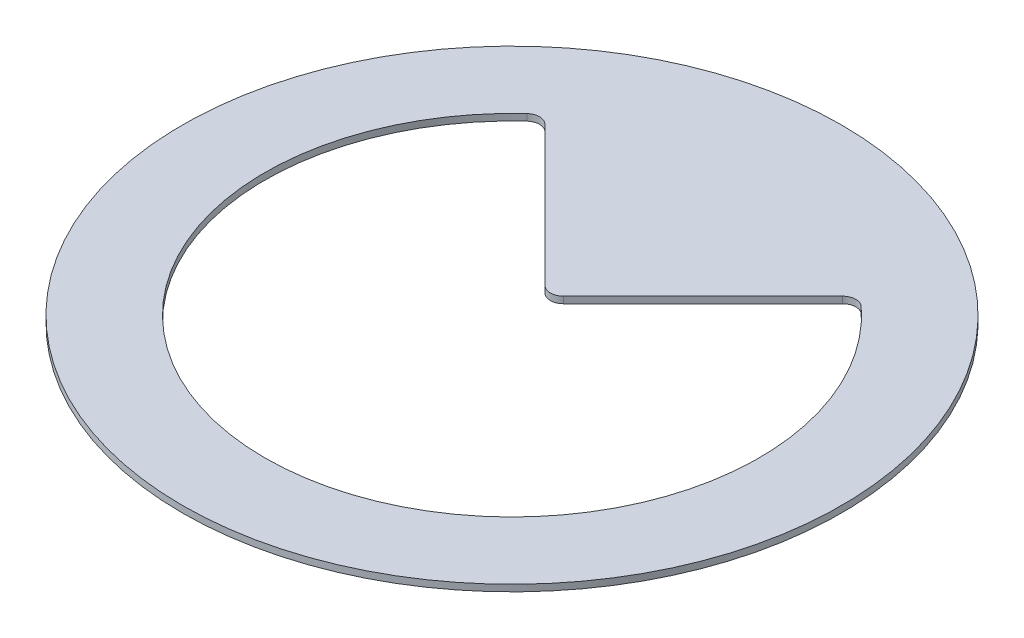
from build123d import *

# Parameters (mm, degrees)
SKETCH1_R           = 50
BOSS_EXTRUDE1_DEPTH = 1
FILLET1_R           = 2


with BuildPart() as part:
    # Sketch1 → Boss-Extrude1 (new body)
    with BuildSketch(Plane(origin=(0, 0, 0), x_dir=(1, 0, 0), z_dir=(0, 1, 0))):
        Circle(SKETCH1_R)
        with BuildLine():
            Line((-23.898390102, 28.898390102), (0, 5))
            Line((0, 5), (23.898390102, 28.898390102))
            ThreePointArc((23.898390102, 28.898390102), (0, -37.5), (-23.898390102, 28.898390102))
        make_face(mode=Mode.SUBTRACT)
    extrude(amount=BOSS_EXTRUDE1_DEPTH)

    # Fillet1
    fillet1_edges = [part.edges().sort_by_distance(p)[0] for p in [
        (-23.898390102, 0.5, -28.898390102),
        (23.898390102, 0.5, -28.898390102),
        (0, 0.5, -5),
    ]]
    fillet(fillet1_edges, radius=FILLET1_R)


solid = part.part
